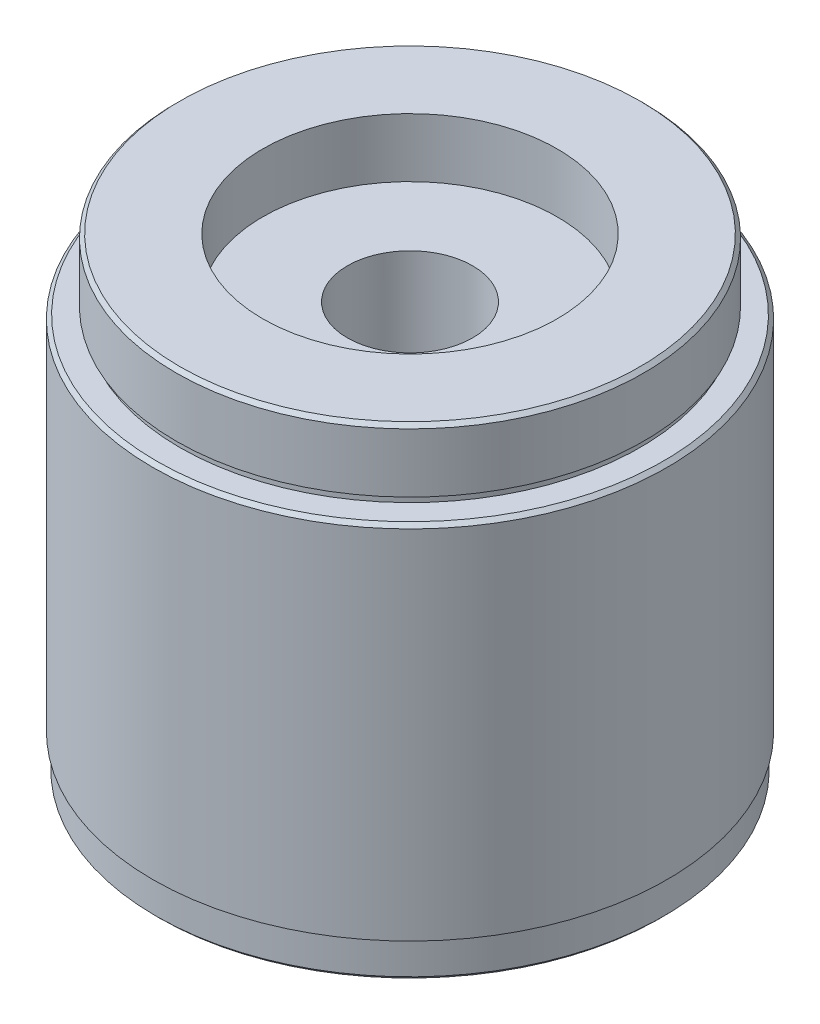
from build123d import *

# Parameters (mm, degrees)
SKETCH1_R           = 34.925
BOSS_EXTRUDE1_DEPTH = 63.5
SKETCH2_OUTSIDE_W   = 95.336
SKETCH2_OUTSIDE_H   = 95.336
SKETCH2_OUTSIDE_R   = 34.5
CUT_EXTRUDE1_DEPTH  = 5
SKETCH3_OUTSIDE_W   = 95.336
SKETCH3_OUTSIDE_H   = 95.336
SKETCH3_OUTSIDE_R   = 31.75
CUT_EXTRUDE2_DEPTH  = 9.52
SKETCH4_OUTSIDE_W   = 95.336
SKETCH4_OUTSIDE_H   = 95.336
SKETCH4_OUTSIDE_R   = 31.25
CUT_EXTRUDE3_DEPTH  = 1
SKETCH5_R           = 20
CUT_EXTRUDE4_DEPTH  = 8
SKETCH6_R           = 8.5
CUT_EXTRUDE5_DEPTH  = 81.447257567
SKETCH7_R           = 14.5
CUT_EXTRUDE6_DEPTH  = 5
CHAMFER1_SIZE       = 0.5
CHAMFER1_SIZE2      = 0.499999887
CHAMFER2_SIZE       = 0.5
CHAMFER2_SIZE2      = 0.499999887
CHAMFER3_SIZE       = 0.5
CHAMFER3_SIZE2      = 0.499999887


with BuildPart() as part:
    # Sketch1 → Boss-Extrude1 (new body)
    with BuildSketch(Plane(origin=(0, 0, 0), x_dir=(1, 0, 0), z_dir=(0, 1, 0))):
        Circle(SKETCH1_R)
    extrude(amount=BOSS_EXTRUDE1_DEPTH)

    # Sketch2 outside → Cut-Extrude1 (cut)
    with BuildSketch(Plane.XZ):
        Rectangle(SKETCH2_OUTSIDE_W, SKETCH2_OUTSIDE_H)
        Circle(SKETCH2_OUTSIDE_R, mode=Mode.SUBTRACT)
    extrude(amount=-CUT_EXTRUDE1_DEPTH, mode=Mode.SUBTRACT)

    # Sketch3 outside → Cut-Extrude2 (cut)
    with BuildSketch(Plane(origin=(0, 63.5, 0), x_dir=(1, 0, 0), z_dir=(0, 1, 0))):
        Rectangle(SKETCH3_OUTSIDE_W, SKETCH3_OUTSIDE_H)
        Circle(SKETCH3_OUTSIDE_R, mode=Mode.SUBTRACT)
    extrude(amount=-CUT_EXTRUDE2_DEPTH, mode=Mode.SUBTRACT)

    # Sketch4 outside → Cut-Extrude3 (cut)
    with BuildSketch(Plane(origin=(0, 53.98, 0), x_dir=(1, 0, 0), z_dir=(0, 1, 0))):
        Rectangle(SKETCH4_OUTSIDE_W, SKETCH4_OUTSIDE_H)
        Circle(SKETCH4_OUTSIDE_R, mode=Mode.SUBTRACT)
    extrude(amount=CUT_EXTRUDE3_DEPTH, mode=Mode.SUBTRACT)

    # Sketch5 → Cut-Extrude4 (cut)
    with BuildSketch(Plane(origin=(0, 63.5, 0), x_dir=(1, 0, 0), z_dir=(0, 1, 0))):
        Circle(SKETCH5_R)
    extrude(amount=-CUT_EXTRUDE4_DEPTH, mode=Mode.SUBTRACT)

    # Sketch6 → Cut-Extrude5 (cut, through all)
    with BuildSketch(Plane.XZ):
        Circle(SKETCH6_R)
    extrude(amount=-CUT_EXTRUDE5_DEPTH, mode=Mode.SUBTRACT)

    # Sketch7 → Cut-Extrude6 (cut)
    with BuildSketch(Plane.XZ):
        Circle(SKETCH7_R)
    extrude(amount=-CUT_EXTRUDE6_DEPTH, mode=Mode.SUBTRACT)

    # Chamfer1
    chamfer1_edges = [part.edges().sort_by_distance(p)[0] for p in [
        (-34.5, 0, 0),
    ]]
    chamfer1_side = [part.faces().sort_by_distance(p)[0] for p in [
        (-33.524192642, 0, 0),
    ]]
    chamfer(chamfer1_edges, length=CHAMFER1_SIZE, length2=CHAMFER1_SIZE2, reference=chamfer1_side[0])

    # Chamfer2
    chamfer2_edges = [part.edges().sort_by_distance(p)[0] for p in [
        (-31.75, 63.5, 0),
    ]]
    chamfer2_side = [part.faces().sort_by_distance(p)[0] for p in [
        (-30.851974388, 63.5, 0),
    ]]
    chamfer(chamfer2_edges, length=CHAMFER2_SIZE, length2=CHAMFER2_SIZE2, reference=chamfer2_side[0])

    # Chamfer3
    chamfer3_edges = [part.edges().sort_by_distance(p)[0] for p in [
        (-34.925, 53.98, 0),
    ]]
    chamfer3_side = [part.faces().sort_by_distance(p)[0] for p in [
        (-33.937171827, 53.98, 0),
    ]]
    chamfer(chamfer3_edges, length=CHAMFER3_SIZE, length2=CHAMFER3_SIZE2, reference=chamfer3_side[0])


solid = part.part
